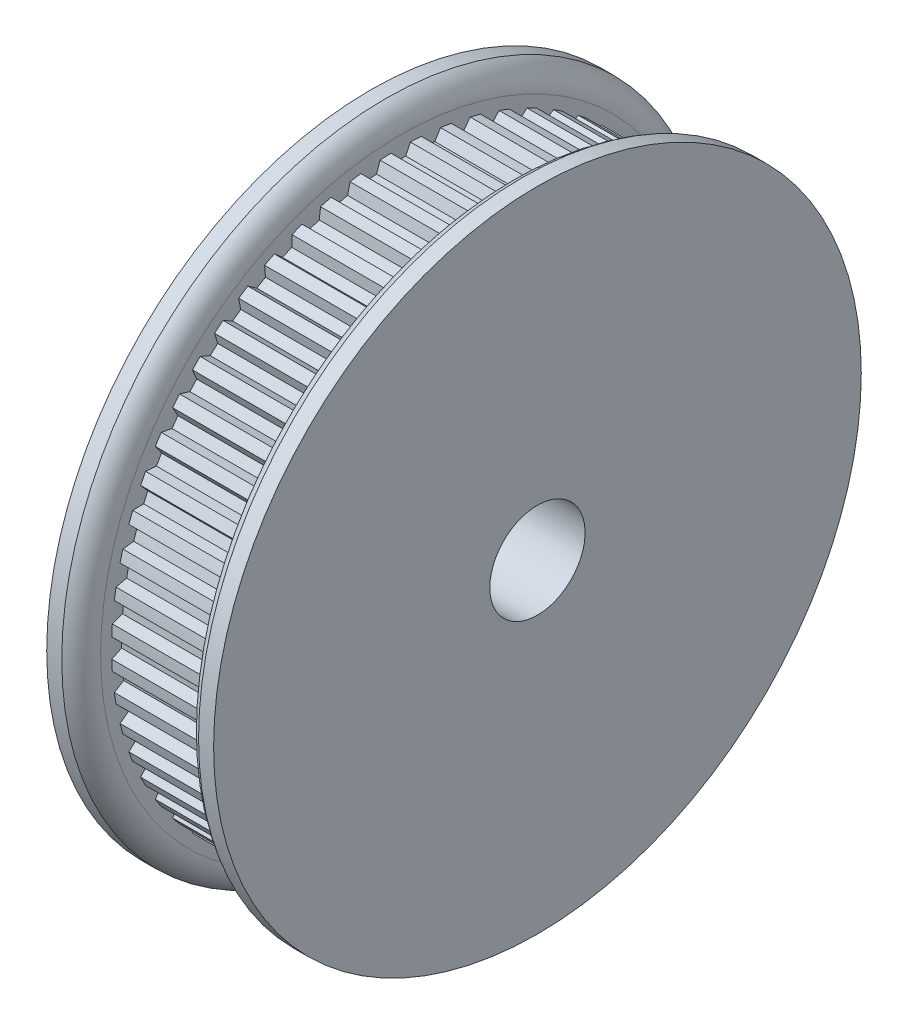
from build123d import *

# Parameters (mm, degrees)
SKETCH4_R          = 19.431
SKETCH4_R_2        = 19.27225
CUT_EXTRUDE2_DEPTH = 7.112
CUT_EXTRUDE1_DEPTH = 7.112
CIRPATTERN1_COUNT  = 60


with BuildPart() as part:
    # Sketch1 → Revolve1 (revolve)
    with BuildSketch(Plane.XY, mode=Mode.PRIVATE) as revolve1_sk:
        with BuildLine():
            Line((-8.7376, 3.175), (8.7376, 3.175))
            Line((8.7376, 3.175), (8.7376, 21.59))
            Line((8.7376, 21.59), (7.7343, 21.59))
            ThreePointArc((7.7343, 21.59), (7.002848665, 20.941484443), (6.731, 20.0025))
            Line((6.731, 20.0025), (6.731, 19.431))
            Line((6.731, 19.431), (-0.381, 19.431))
            Line((-0.381, 19.431), (-0.381, 20.0025))
            ThreePointArc((-0.381, 20.0025), (-0.652848665, 20.941484443), (-1.3843, 21.59))
            Line((-1.3843, 21.59), (-2.3876, 21.59))
            Line((-2.3876, 21.59), (-2.3876, 8.7376))
            Line((-2.3876, 8.7376), (-8.7376, 8.7376))
            Line((-8.7376, 8.7376), (-8.7376, 3.175))
        make_face()
    revolve(revolve1_sk.sketch.rotate(Axis((-8.7376, 0, 0), (1, 0, 0)), 90), axis=Axis((-8.7376, 0, 0), (1, 0, 0)))

    # Sketch4 → Cut-Extrude2 (cut)
    with BuildSketch(Plane(origin=(-0.381, 0, 0), x_dir=(0, 0, -1), z_dir=(1, 0, 0))):
        Circle(SKETCH4_R)
        Circle(SKETCH4_R_2, mode=Mode.SUBTRACT)
    extrude(amount=CUT_EXTRUDE2_DEPTH, mode=Mode.SUBTRACT)

    # Sketch3 → Cut-Extrude1 (cut)
    with BuildSketch(Plane(origin=(-0.381, 0, 0), x_dir=(0, 0, -1), z_dir=(1, 0, 0))):
        with BuildLine():
            Line((-0.644484972, 19.261470847), (-0.337175955, 18.602444534))
            Line((-0.337175955, 18.602444534), (0.337175955, 18.602444534))
            Line((0.337175955, 18.602444534), (0.644484972, 19.261470847))
            ThreePointArc((0.644484972, 19.261470847), (0, 19.27225), (-0.644484972, 19.261470847))
        make_face()
    cut_extrude1 = extrude(amount=CUT_EXTRUDE1_DEPTH, mode=Mode.SUBTRACT)

    # CirPattern1: Cut-Extrude1 ×60 about axis
    cirpattern1_axis = Axis((0, 0, 0), (1, 0, 0))
    for i in range(1, CIRPATTERN1_COUNT):
        add(cut_extrude1.rotate(cirpattern1_axis, i * 360 / CIRPATTERN1_COUNT), mode=Mode.SUBTRACT)


solid = part.part
